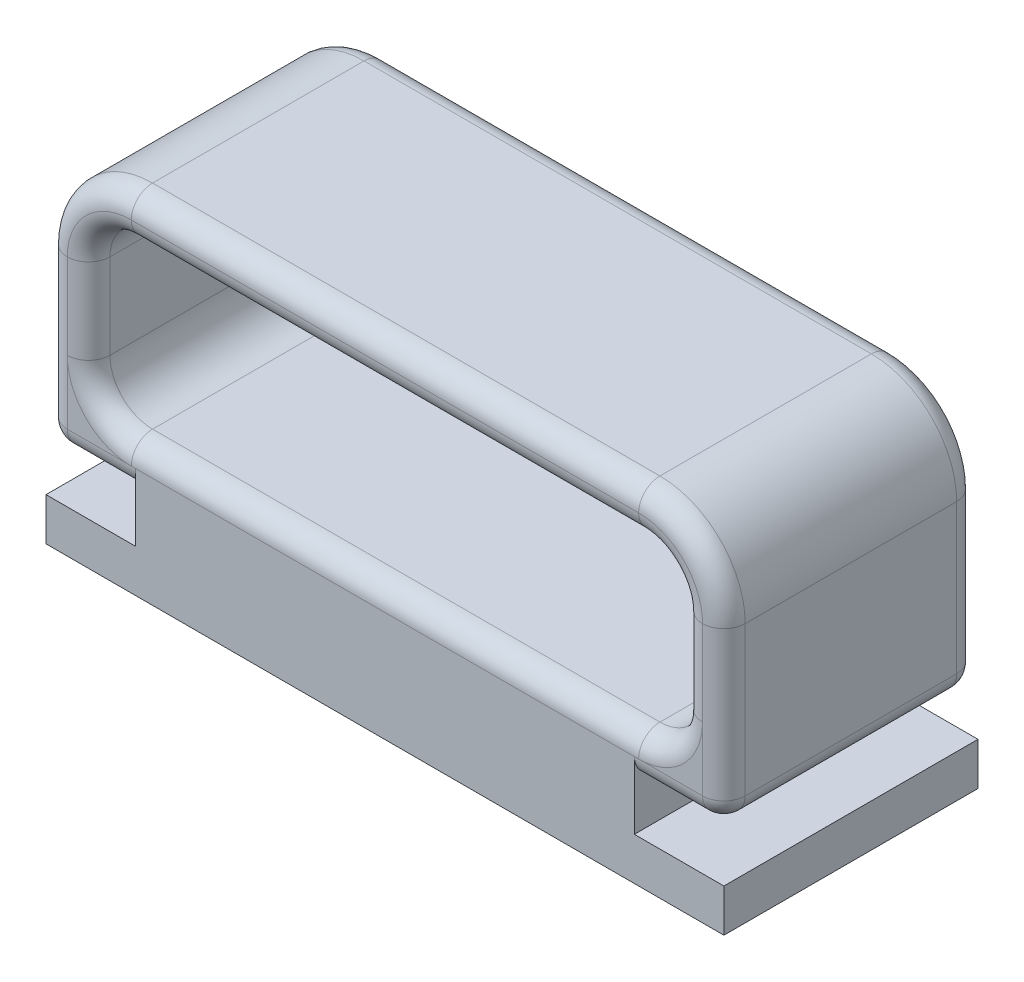
from build123d import *

# Parameters (mm, degrees)
EXTRUDE_2_DEPTH = 29.8
FILLET_3_R      = 2.5


with BuildPart() as part:
    # Эскиз1 → Бобышка-Вытянуть2 (new body)
    with BuildSketch(Plane.XY):
        with BuildLine():
            Line((0, 0), (79.5, 0))
            Line((79.5, 0), (79.5, 5))
            Line((79.5, 5), (69, 5))
            Line((69, 5), (69, 10.4))
            Line((69, 10.4), (77, 10.4))
            ThreePointArc((77, 10.4), (78.767766953, 11.132233047), (79.5, 12.9))
            Line((79.5, 12.9), (79.5, 30.395890056))
            ThreePointArc((79.5, 30.395890056), (76.571067812, 37.466957868), (69.5, 40.395890056))
            Line((69.5, 40.395890056), (10, 40.395890056))
            ThreePointArc((10, 40.395890056), (2.928932188, 37.466957868), (0, 30.395890056))
            Line((0, 30.395890056), (0, 12.9))
            ThreePointArc((0, 12.9), (0.732233047, 11.132233047), (2.5, 10.4))
            Line((2.5, 10.4), (10.5, 10.4))
            Line((10.5, 10.4), (10.5, 5))
            Line((10.5, 5), (0, 5))
            Line((0, 5), (0, 0))
        make_face()
        with BuildLine():
            Line((10, 35.395890056), (69.5, 35.395890056))
            ThreePointArc((69.5, 35.395890056), (73.035533906, 33.931423962), (74.5, 30.395890056))
            Line((74.5, 30.395890056), (74.5, 20.4))
            ThreePointArc((74.5, 20.4), (73.035533906, 16.864466094), (69.5, 15.4))
            Line((69.5, 15.4), (10, 15.4))
            ThreePointArc((10, 15.4), (6.464466094, 16.864466094), (5, 20.4))
            Line((5, 20.4), (5, 30.395890056))
            ThreePointArc((5, 30.395890056), (6.464466094, 33.931423962), (10, 35.395890056))
        make_face(mode=Mode.SUBTRACT)
    extrude(amount=EXTRUDE_2_DEPTH)

    # Скругление3
    fillet_3_edges = [part.edges().sort_by_distance(p)[0] for p in [
        (6.5, 10.4, 0),
        (0.732233047, 11.132233047, 0),
        (0, 21.647945028, 0),
        (2.928932188, 37.466957868, 0),
        (39.75, 40.395890056, 0),
        (76.571067812, 37.466957868, 0),
        (79.5, 21.647945028, 0),
        (78.767766953, 11.132233047, 0),
        (73, 10.4, 0),
        (73, 10.4, 29.8),
        (78.767766953, 11.132233047, 29.8),
        (79.5, 21.647945028, 29.8),
        (76.571067812, 37.466957868, 29.8),
        (39.75, 40.395890056, 29.8),
        (2.928932188, 37.466957868, 29.8),
        (73.035533906, 33.931423962, 0),
        (39.75, 35.395890056, 0),
        (6.464466094, 33.931423962, 0),
        (5, 25.397945028, 0),
        (6.464466094, 16.864466094, 0),
        (39.75, 15.4, 0),
        (73.035533906, 16.864466094, 0),
        (74.5, 25.397945028, 0),
        (0, 21.647945028, 29.8),
        (73.035533906, 33.931423962, 29.8),
        (39.75, 35.395890056, 29.8),
        (6.464466094, 33.931423962, 29.8),
        (5, 25.397945028, 29.8),
        (6.464466094, 16.864466094, 29.8),
        (39.75, 15.4, 29.8),
        (73.035533906, 16.864466094, 29.8),
        (74.5, 25.397945028, 29.8),
        (0.732233047, 11.132233047, 29.8),
        (6.5, 10.4, 29.8),
    ]]
    fillet(fillet_3_edges, radius=FILLET_3_R - 0.0001)  # a hair under: the kernel refuses the full size


solid = part.part
